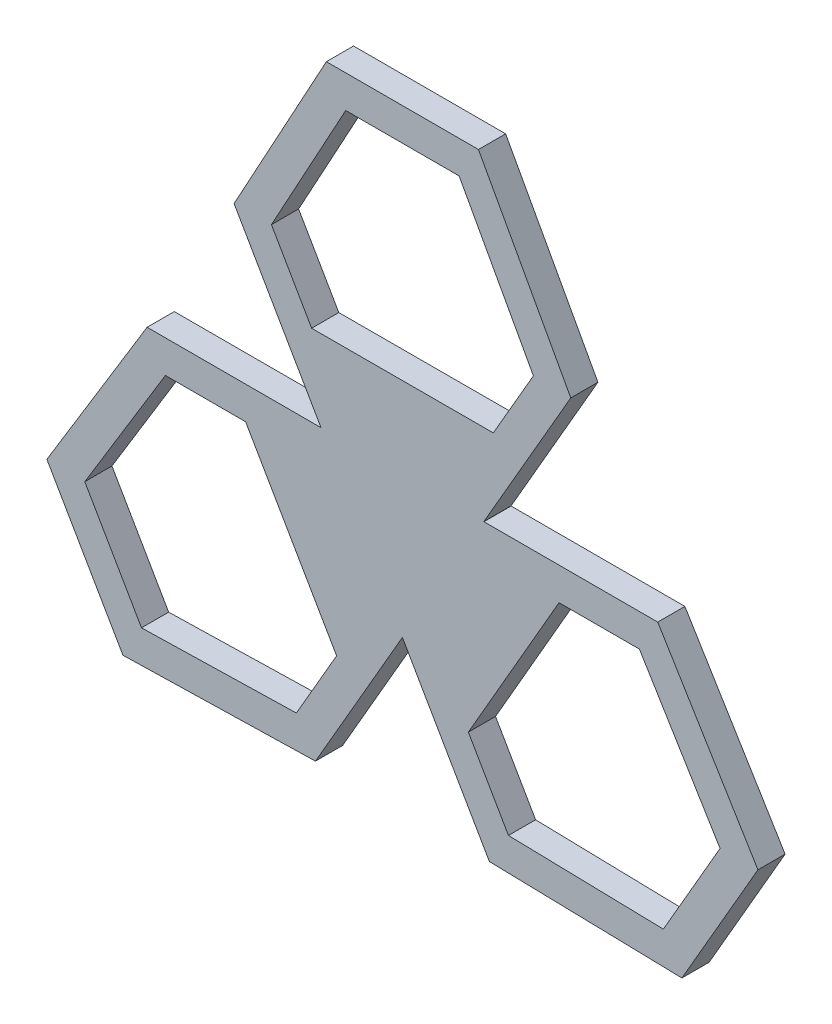
from build123d import *

# Parameters (mm, degrees)
BOSS_EXTRUDE1_DEPTH = 5
CUT_EXTRUDE1_DEPTH  = 95.158544522


with BuildPart() as part:
    # Sketch1 → Boss-Extrude1 (new body)
    with BuildSketch(Plane.XY):
        Polygon((-30.995, 36.381727213), (-14, 67.5), (14, 67.5), (30.995, 36.381727213), (14.995, 8.668914292), (15, 8.660254038), (15.005, 8.651593784), (47.005, 8.651593784), (65.456714755, -21.625644347), (51.456714755, -45.874355653), (16.01, -45.033320997), (0.01, -17.320508076), (0, -17.320508076), (-0.01, -17.320508076), (-16.01, -45.033320997), (-51.456714755, -45.874355653), (-65.456714755, -21.625644347), (-47.005, 8.651593784), (-15.005, 8.651593784), (-15, 8.660254038), (-14.995, 8.668914292), align=None)
    extrude(amount=BOSS_EXTRUDE1_DEPTH)

    # Sketch2 → Cut-Extrude1 (cut, through all)
    with BuildSketch(Plane.XY.offset(5)):
        Polygon((-28.872149716, 2.651593784), (-12.118974925, -26.293867874), (-19.521225678, -39.114942267), (-48.040387098, -39.791608731), (-58.480737567, -21.708391269), (-43.63514651, 2.651593784), align=None)
        Polygon((-24.113920832, 36.463348484), (-16.71167008, 23.64227409), (16.732422435, 23.678218224), (24.113920832, 36.463348484), (10.440350469, 61.5), (-10.440350469, 61.5), align=None)
        Polygon((43.63514651, 2.651593784), (28.830645005, 2.651593784), (12.139727281, -26.329812008), (19.521225678, -39.114942267), (48.040387098, -39.791608731), (58.480737567, -21.708391269), align=None)
    extrude(amount=-CUT_EXTRUDE1_DEPTH, mode=Mode.SUBTRACT)


solid = part.part
